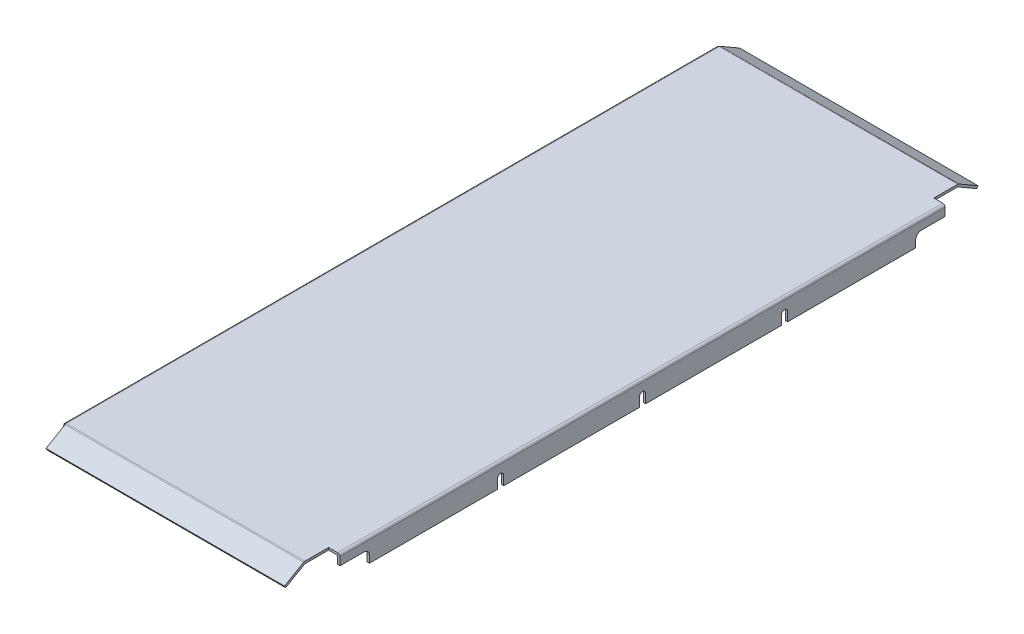
from build123d import *

# Parameters (mm, degrees)
SKIZZE9_W                       = 220
SKIZZE9_H                       = 575
BASIS_BLECH2_DEPTH              = 2
KANTE_LASCHE3_STRIP_W           = 8.2
KANTE_LASCHE3_STRIP_H           = 2
KANTE_LASCHE3_STRIP_CUT_DEPTH   = 575
KANTE_LASCHE3_DEPTH             = 575
KANTE_LASCHE3_FLAT_DEPTH        = 2
KANTE_LASCHE4_STRIP_CUT_DEPTH   = 217.9
KANTE_LASCHE4_STRIP_CUT_2_DEPTH = 217.9
KANTE_LASCHE4_DEPTH             = 217.9
KANTE_LASCHE4_BEND_DEPTH        = 217.9
SKIZZE43_W                      = 10
SKIZZE43_H                      = 42
SCHNITT_LINEAR_AUSTRAGEN4_DEPTH = 326.18077275
KANTE_LASCHE5_DEPTH             = 574.994641016


# Sheet-metal steps are written as plain solids
with BuildPart() as part:
    # Skizze9 → Basis-Blech2 (new body)
    with BuildSketch(Plane(origin=(0, 0, 0), x_dir=(1, 0, 0), z_dir=(0, 1, 0))):
        Rectangle(SKIZZE9_W, SKIZZE9_H)
    extrude(amount=-BASIS_BLECH2_DEPTH)

    # Kante-Lasche3 strip (across the edge) → Kante-Lasche3 strip cut (cut)
    with BuildSketch(Plane(origin=(110, -2, -287.5), x_dir=(-1, 0, 0), z_dir=(0, 0, 1))):
        with Locations((-2, -1)):
            Rectangle(KANTE_LASCHE3_STRIP_W, KANTE_LASCHE3_STRIP_H)
    extrude(amount=KANTE_LASCHE3_STRIP_CUT_DEPTH, mode=Mode.SUBTRACT)

    # Kante-Lasche3 bend section (across the edge) → Kante-Lasche3 (add)
    with BuildSketch(Plane(origin=(110, -2, -287.5), x_dir=(-1, 0, 0), z_dir=(0, 0, 1))):
        with BuildLine():
            Line((0, 0.1), (2, 0.1))
            ThreePointArc((2, 0.1), (2.029289322, 0.029289322), (2.1, 0))
            Line((2.1, 0), (2.1, -2))
            ThreePointArc((2.1, -2), (0.61507576, -1.38492424), (0, 0.1))
        make_face()
    extrude(amount=KANTE_LASCHE3_DEPTH)

    # Kante-Lasche3 profile (on flange) → Kante-Lasche3 flat (add)
    with BuildSketch(Plane(origin=(110, -2, 0), x_dir=(0, 0, 1), z_dir=(1, 0, 0))):
        with BuildLine():
            Line((287.5, 0.1), (287.5, 7))
            Line((287.5, 7), (245.5, 7))
            ThreePointArc((245.5, 7), (241.964466094, 8.464466094), (240.5, 12))
            Line((240.5, 12), (240.5, 18))
            Line((240.5, 18), (127.7, 18))
            Line((127.7, 18), (127.7, 10))
            ThreePointArc((127.7, 10), (125, 7.3), (122.3, 10))
            Line((122.3, 10), (122.3, 18))
            Line((122.3, 18), (2.7, 18))
            Line((2.7, 18), (2.7, 10))
            ThreePointArc((2.7, 10), (0, 7.3), (-2.7, 10))
            Line((-2.7, 10), (-2.7, 18))
            Line((-2.7, 18), (-122.3, 18))
            Line((-122.3, 18), (-122.3, 10))
            ThreePointArc((-122.3, 10), (-125, 7.3), (-127.7, 10))
            Line((-127.7, 10), (-127.7, 18))
            Line((-127.7, 18), (-240.5, 18))
            Line((-240.5, 18), (-240.5, 12))
            ThreePointArc((-240.5, 12), (-241.964466094, 8.464466094), (-245.5, 7))
            Line((-245.5, 7), (-287.5, 7))
            Line((-287.5, 7), (-287.5, 0.1))
            Line((-287.5, 0.1), (287.5, 0.1))
        make_face()
    extrude(amount=-KANTE_LASCHE3_FLAT_DEPTH)

    # Kante-Lasche4 strip (across the edge) → Kante-Lasche4 strip cut (cut)
    with BuildSketch(Plane(origin=(-110, -2, -287.5), x_dir=(0, -0.8660254037844416, 0.49999999999999495), z_dir=(1, 0, 0))):
        Polygon((-5.740711062, 5.94320323), (-1.730711062, -1.002320508), (0.001339746, -0.002320508), (-4.008660254, 6.94320323), align=None)
    extrude(amount=KANTE_LASCHE4_STRIP_CUT_DEPTH, mode=Mode.SUBTRACT)

    # Kante-Lasche4 strip 2 (across the edge) → Kante-Lasche4 strip cut 2 (cut)
    with BuildSketch(Plane(origin=(107.9, -2, 287.5), x_dir=(0, -0.8660254037844416, -0.49999999999999495), z_dir=(-1, 0, 0))):
        Polygon((-5.740711062, 5.94320323), (-1.730711062, -1.002320508), (0.001339746, -0.002320508), (-4.008660254, 6.94320323), align=None)
    extrude(amount=KANTE_LASCHE4_STRIP_CUT_2_DEPTH, mode=Mode.SUBTRACT)

    # Kante-Lasche4 section (across the edge) → Kante-Lasche4 (add)
    with BuildSketch(Plane(origin=(-110, -2, -287.5), x_dir=(0, -0.8660254037844416, 0.49999999999999495), z_dir=(1, 0, 0))):
        with BuildLine():
            Line((-2, 0.002679492), (-2, 19.464101615))
            Line((-2, 19.464101615), (0, 19.464101615))
            Line((0, 19.464101615), (0, 0.002679492))
            ThreePointArc((0, 0.002679492), (0.000340742, 9.1301e-05), (0.001339746, -0.002320508))
            Line((0.001339746, -0.002320508), (-1.730711062, -1.002320508))
            ThreePointArc((-1.730711062, -1.002320508), (-1.931510911, -0.517546789), (-2, 0.002679492))
        make_face()
    extrude(amount=KANTE_LASCHE4_DEPTH)

    # Kante-Lasche4 section 2 (across the edge) → Kante-Lasche4 bend (add)
    with BuildSketch(Plane(origin=(107.9, -2, 287.5), x_dir=(0, -0.8660254037844416, -0.49999999999999495), z_dir=(-1, 0, 0))):
        with BuildLine():
            Line((-2, 0.002679492), (-2, 19.464101615))
            Line((-2, 19.464101615), (0, 19.464101615))
            Line((0, 19.464101615), (0, 0.002679492))
            ThreePointArc((0, 0.002679492), (0.000340742, 9.1301e-05), (0.001339746, -0.002320508))
            Line((0.001339746, -0.002320508), (-1.730711062, -1.002320508))
            ThreePointArc((-1.730711062, -1.002320508), (-1.931510911, -0.517546789), (-2, 0.002679492))
        make_face()
    extrude(amount=KANTE_LASCHE4_BEND_DEPTH)

    # Skizze43 → Schnitt-Linear austragen4 (cut, through all)
    with BuildSketch(Plane(origin=(0, 0, 0), x_dir=(1, 0, 0), z_dir=(0, 1, 0))):
        with Locations((105, 287.497320508)):
            Rectangle(SKIZZE43_W, SKIZZE43_H)
        with Locations((105, -287.497320508)):
            Rectangle(SKIZZE43_W, SKIZZE43_H)
    extrude(amount=-SCHNITT_LINEAR_AUSTRAGEN4_DEPTH, mode=Mode.SUBTRACT)

    # Kante-Lasche5 section (across the edge) → Kante-Lasche5 (add)
    with BuildSketch(Plane(origin=(-110.083909963, -2, 287.497320508), x_dir=(0.9848077530122075, -0.17364817766693427, 0), z_dir=(0, 0, -1))):
        with BuildLine():
            Line((-2, 0.083909963), (-2, 7))
            Line((-2, 7), (0, 7))
            Line((0, 7), (0, 0.083909963))
            ThreePointArc((0, 0.083909963), (0.023395556, 0.019631202), (0.082635182, -0.014570812))
            Line((0.082635182, -0.014570812), (-0.264661173, -1.984186318))
            ThreePointArc((-0.264661173, -1.984186318), (-1.508693331, -1.265944017), (-2, 0.083909963))
        make_face()
    extrude(amount=KANTE_LASCHE5_DEPTH)


solid = part.part
